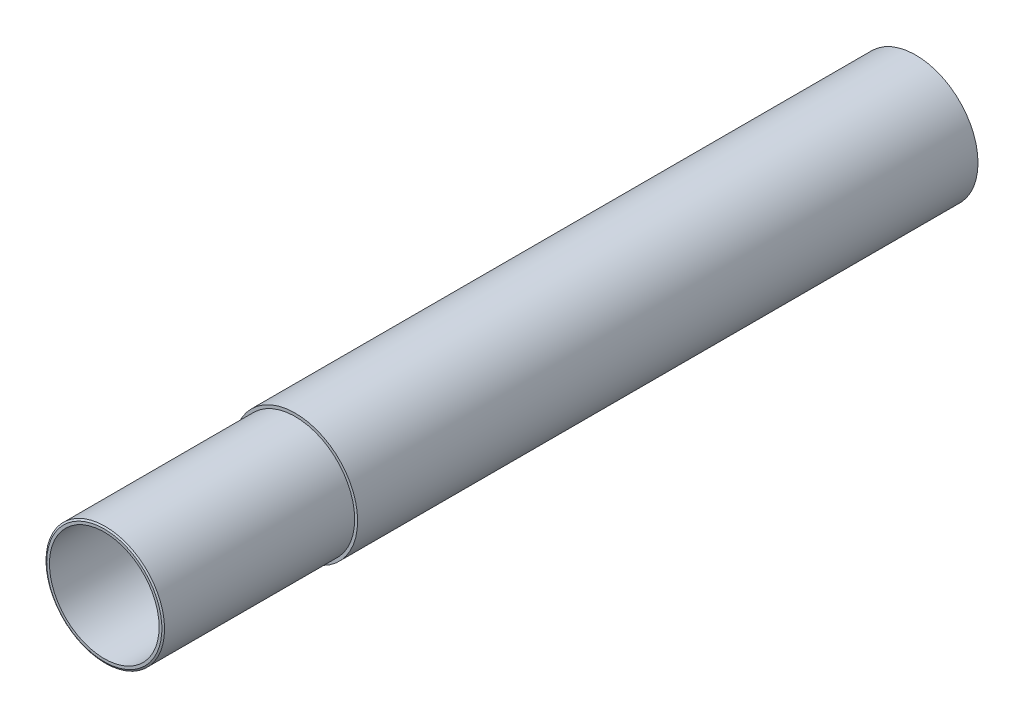
from build123d import *

# Parameters (mm, degrees)
SKETCH3_R           = 33.3375
SKETCH3_R_2         = 29.3751
BOSS_EXTRUDE1_DEPTH = 217.325
SKETCH4_R           = 33.3375
SKETCH4_R_2         = 31.75
CUT_EXTRUDE1_DEPTH  = 102.35


with BuildPart() as part:
    # Sketch3 → Boss-Extrude1 (new, symmetric)
    with BuildSketch(Plane.XY):
        Circle(SKETCH3_R)
        Circle(SKETCH3_R_2, mode=Mode.SUBTRACT)
    extrude(amount=BOSS_EXTRUDE1_DEPTH, both=True)

    # Sketch5 → Cut-Revolve1 (revolve, cut)
    with BuildSketch(Plane(origin=(0, 0, 0), x_dir=(0, 0, -1), z_dir=(1, 0, 0))):
        Polygon((-217.325, 30.8375), (-215.881624327, 33.3375), (-217.325, 33.3375), align=None)
    revolve(axis=Axis((0, 0, 0), (0, 0, 1)), mode=Mode.SUBTRACT)

    # Sketch4 → Cut-Extrude1 (cut)
    with BuildSketch(Plane.XY.offset(217.325)):
        Circle(SKETCH4_R)
        Circle(SKETCH4_R_2, mode=Mode.SUBTRACT)
    extrude(amount=-CUT_EXTRUDE1_DEPTH, mode=Mode.SUBTRACT)


solid = part.part
